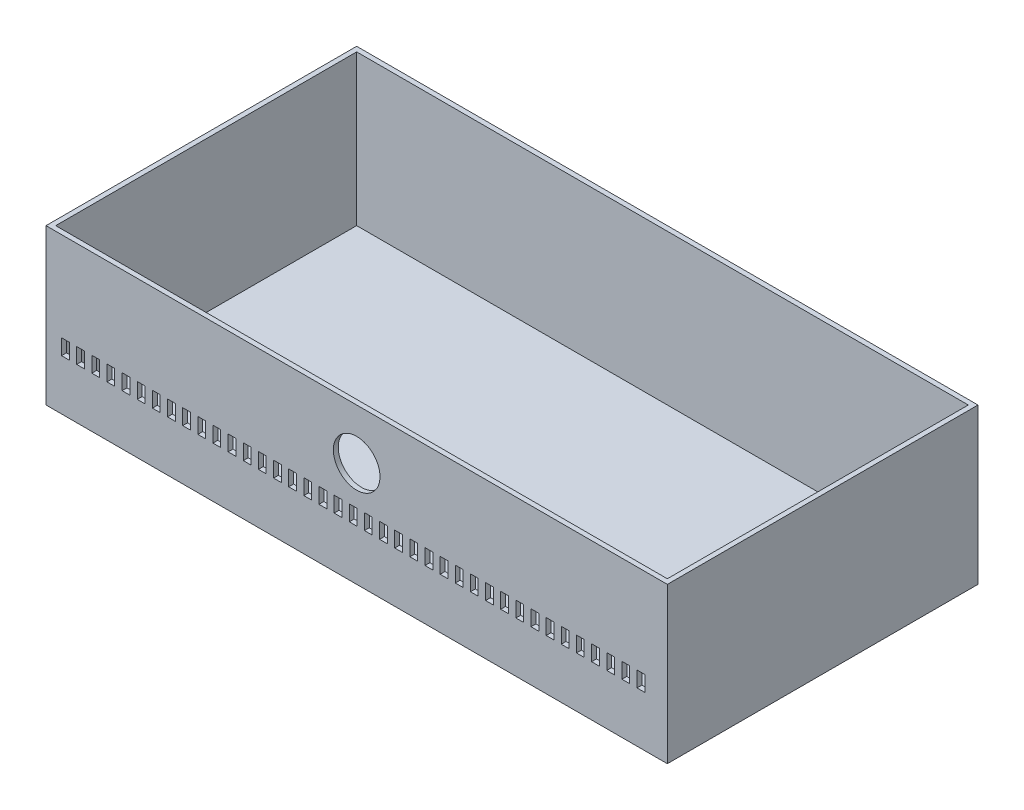
from build123d import *

# Parameters (mm, degrees)
SKETCH1_W           = 203.2
SKETCH1_H           = 101.6
BOSS_EXTRUDE1_DEPTH = 50.8
SKETCH2_W           = 200.025
SKETCH2_H           = 98.425
CUT_EXTRUDE1_DEPTH  = 49.2125
SKETCH3_W           = 2.54
SKETCH3_H           = 5.08
CUT_EXTRUDE2_DEPTH  = 7.62
LPATTERN1_COUNT     = 39
LPATTERN1_PITCH     = 4.953
SKETCH4_R           = 7.62
CUT_EXTRUDE3_DEPTH  = 7.62
SKETCH6_R           = 8.128
CUT_EXTRUDE5_DEPTH  = 7.62


with BuildPart() as part:
    # Sketch1 → Boss-Extrude1 (new body)
    with BuildSketch(Plane(origin=(0, 0, 0), x_dir=(1, 0, 0), z_dir=(0, 1, 0))):
        Rectangle(SKETCH1_W, SKETCH1_H)
    extrude(amount=BOSS_EXTRUDE1_DEPTH)

    # Sketch2 → Cut-Extrude1 (cut)
    with BuildSketch(Plane(origin=(0, 50.8, 0), x_dir=(1, 0, 0), z_dir=(0, 1, 0))):
        Rectangle(SKETCH2_W, SKETCH2_H)
    extrude(amount=-CUT_EXTRUDE1_DEPTH, mode=Mode.SUBTRACT)

    # Sketch3 → Cut-Extrude2 (cut)
    with BuildSketch(Plane.XY.offset(50.8)):
        with Locations((-95.25, 19.05)):
            Rectangle(SKETCH3_W, SKETCH3_H)
    cut_extrude2 = extrude(amount=-CUT_EXTRUDE2_DEPTH, mode=Mode.SUBTRACT)

    # LPattern1: Cut-Extrude2 ×39
    with Locations(*[(i * LPATTERN1_PITCH, 0, 0) for i in range(1, LPATTERN1_COUNT)]):
        add(cut_extrude2, mode=Mode.SUBTRACT)

    # Sketch4 → Cut-Extrude3 (cut)
    with BuildSketch(Plane.XY.offset(50.8)):
        with Locations((0, 34.29)):
            Circle(SKETCH4_R)
    extrude(amount=-CUT_EXTRUDE3_DEPTH, mode=Mode.SUBTRACT)

    # Sketch6 → Cut-Extrude5 (cut)
    with BuildSketch(Plane(origin=(0, 0, -50.8), x_dir=(-1, 0, 0), z_dir=(0, 0, -1))):
        with Locations((-88.9, 12.7)):
            Circle(SKETCH6_R)
    extrude(amount=-CUT_EXTRUDE5_DEPTH, mode=Mode.SUBTRACT)


solid = part.part
